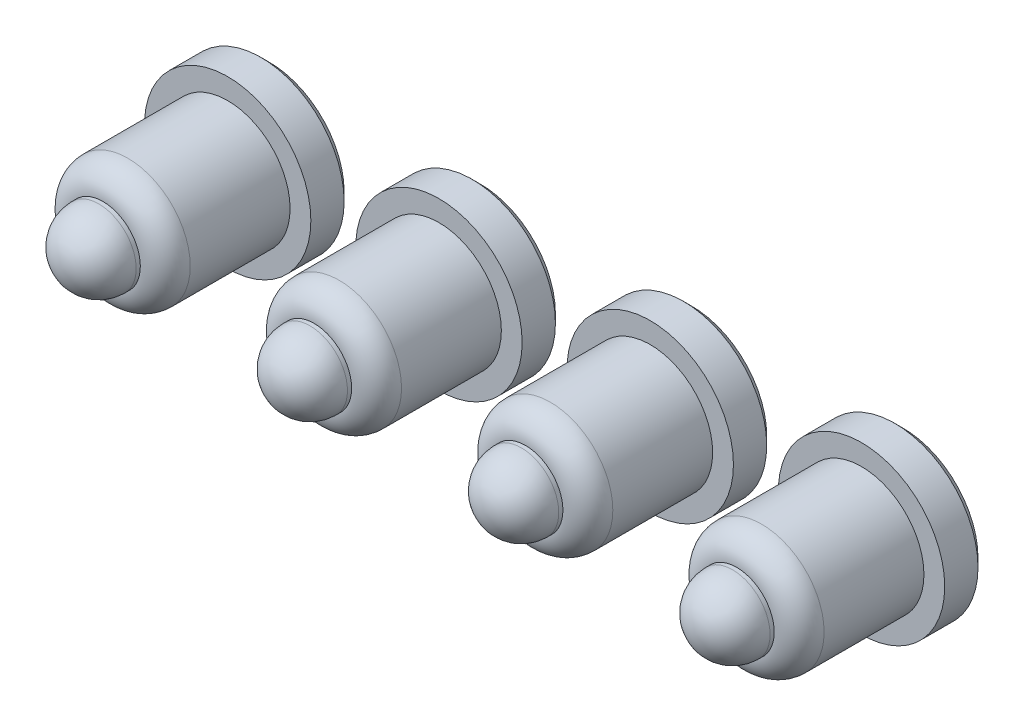
from build123d import *

# Parameters (mm, degrees)
SKETCH_1_R        = 0.75
EXTRUDE_1_DEPTH   = 1.5
EXTRUDE_1_2_DEPTH = 1.5
EXTRUDE_1_3_DEPTH = 1.5
EXTRUDE_1_4_DEPTH = 1.5
SKETCH_2_R        = 1
EXTRUDE_2_DEPTH   = 0.5
SKETCH_3_R        = 0.45
EXTRUDE_3_DEPTH   = 0.5
FILLET_1_R        = 0.3
FILLET_2_R        = 0.45
CHAMFER_1_SIZE    = 0.1
CHAMFER_2_SIZE    = 0.1
CHAMFER_3_SIZE    = 0.1
CHAMFER_4_SIZE    = 0.1
FILLET_3_R        = 0.3
FILLET_4_R        = 0.3
FILLET_5_R        = 0.3
FILLET_6_R        = 0.45
FILLET_7_R        = 0.45
FILLET_8_R        = 0.45


with BuildPart() as part:
    # 草图1 → 凸台-拉伸1 (new body)
    with BuildSketch(Plane.XY):
        Circle(SKETCH_1_R)
    extrude(amount=EXTRUDE_1_DEPTH)

    # 草图2 → 凸台-拉伸2 (add)
    with BuildSketch(Plane.XY):
        Circle(SKETCH_2_R)
        with Locations((2.54, 0)):
            Circle(SKETCH_2_R)
        with Locations((5.08, 0)):
            Circle(SKETCH_2_R)
        with Locations((7.62, 0)):
            Circle(SKETCH_2_R)
    extrude(amount=-EXTRUDE_2_DEPTH)


with BuildPart() as body_2:
    # 草图1 → Extrude 1 2 (new body)
    with BuildSketch(Plane.XY):
        with Locations((2.54, 0)):
            Circle(SKETCH_1_R)
    extrude(amount=EXTRUDE_1_2_DEPTH)

    # 圆角3
    fillet_3_edges = [body_2.edges().sort_by_distance(p)[0] for p in [
        (1.79, 0, 1.5),
    ]]
    fillet(fillet_3_edges, radius=FILLET_3_R)


with BuildPart() as body_3:
    # 草图1 → Extrude 1 3 (new body)
    with BuildSketch(Plane.XY):
        with Locations((5.08, 0)):
            Circle(SKETCH_1_R)
    extrude(amount=EXTRUDE_1_3_DEPTH)

    # 圆角4
    fillet_4_edges = [body_3.edges().sort_by_distance(p)[0] for p in [
        (4.33, 0, 1.5),
    ]]
    fillet(fillet_4_edges, radius=FILLET_4_R)


with BuildPart() as body_4:
    # 草图1 → Extrude 1 4 (new body)
    with BuildSketch(Plane.XY):
        with Locations((7.62, 0)):
            Circle(SKETCH_1_R)
    extrude(amount=EXTRUDE_1_4_DEPTH)

    # 圆角5
    fillet_5_edges = [body_4.edges().sort_by_distance(p)[0] for p in [
        (6.87, 0, 1.5),
    ]]
    fillet(fillet_5_edges, radius=FILLET_5_R)


with BuildPart() as extrude_2_piece_1:
    # of the separate pieces the step leaves, piece 1, a body of its own (extrude_2_pieces)
    add(part.part.solids().sort_by_distance((1, 0, 0))[0])

    # 草图3 → 凸台-拉伸3 (add)
    with BuildSketch(Plane.XY.offset(1.5)):
        Circle(SKETCH_3_R)
        with Locations((2.54, 0)):
            Circle(SKETCH_3_R)
        with Locations((5.08, 0)):
            Circle(SKETCH_3_R)
        with Locations((7.62, 0)):
            Circle(SKETCH_3_R)
    extrude(amount=EXTRUDE_3_DEPTH)


with BuildPart() as extrude_2_piece_2:
    # of the separate pieces the step leaves, piece 2, a body of its own (extrude_2_pieces)
    add(part.part.solids().sort_by_distance((3.54, 0, 0))[0])

    # 倒角1
    chamfer_1_edges = [extrude_2_piece_2.edges().sort_by_distance(p)[0] for p in [
        (1.54, 0, -0.5),
    ]]
    chamfer(chamfer_1_edges, length=CHAMFER_1_SIZE)


with BuildPart() as extrude_2_piece_3:
    # of the separate pieces the step leaves, piece 3, a body of its own (extrude_2_pieces)
    add(part.part.solids().sort_by_distance((6.08, 0, 0))[0])

    # 倒角3
    chamfer_3_edges = [extrude_2_piece_3.edges().sort_by_distance(p)[0] for p in [
        (4.08, 0, -0.5),
    ]]
    chamfer(chamfer_3_edges, length=CHAMFER_3_SIZE)


with BuildPart() as extrude_2_piece_4:
    # of the separate pieces the step leaves, piece 4, a body of its own (extrude_2_pieces)
    add(part.part.solids().sort_by_distance((8.62, 0, 0))[0])

    # 倒角4
    chamfer_4_edges = [extrude_2_piece_4.edges().sort_by_distance(p)[0] for p in [
        (6.62, 0, -0.5),
    ]]
    chamfer(chamfer_4_edges, length=CHAMFER_4_SIZE)


with BuildPart() as extrude_3_piece_1:
    # of the separate pieces the step leaves, piece 1, a body of its own (extrude_3_pieces)
    add(extrude_2_piece_1.part.solids().sort_by_distance((1, 0, 0))[0])

    # 圆角1
    fillet_1_edges = [extrude_3_piece_1.edges().sort_by_distance(p)[0] for p in [
        (-0.75, 0, 1.5),
    ]]
    fillet(fillet_1_edges, radius=FILLET_1_R - 0.0001)  # a hair under: the kernel refuses the full size

    # 圆角2
    fillet_2_edges = [extrude_3_piece_1.edges().sort_by_distance(p)[0] for p in [
        (-0.45, 0, 2),
    ]]
    fillet(fillet_2_edges, radius=FILLET_2_R)

    # 倒角2
    chamfer_2_edges = [extrude_3_piece_1.edges().sort_by_distance(p)[0] for p in [
        (-1, 0, -0.5),
    ]]
    chamfer(chamfer_2_edges, length=CHAMFER_2_SIZE)


with BuildPart() as extrude_3_piece_2:
    # of the separate pieces the step leaves, piece 2, a body of its own (extrude_3_pieces)
    add(extrude_2_piece_1.part.solids().sort_by_distance((2.99, 0, 1.5))[0])

    # 圆角6
    fillet_6_edges = [extrude_3_piece_2.edges().sort_by_distance(p)[0] for p in [
        (2.09, 0, 2),
    ]]
    fillet(fillet_6_edges, radius=FILLET_6_R)


with BuildPart() as extrude_3_piece_3:
    # of the separate pieces the step leaves, piece 3, a body of its own (extrude_3_pieces)
    add(extrude_2_piece_1.part.solids().sort_by_distance((5.53, 0, 1.5))[0])

    # 圆角7
    fillet_7_edges = [extrude_3_piece_3.edges().sort_by_distance(p)[0] for p in [
        (4.63, 0, 2),
    ]]
    fillet(fillet_7_edges, radius=FILLET_7_R)


with BuildPart() as extrude_3_piece_4:
    # of the separate pieces the step leaves, piece 4, a body of its own (extrude_3_pieces)
    add(extrude_2_piece_1.part.solids().sort_by_distance((8.07, 0, 1.5))[0])

    # 圆角8
    fillet_8_edges = [extrude_3_piece_4.edges().sort_by_distance(p)[0] for p in [
        (7.17, 0, 2),
    ]]
    fillet(fillet_8_edges, radius=FILLET_8_R)


solid = Compound([body_2.part, body_3.part, body_4.part, extrude_2_piece_2.part, extrude_2_piece_3.part, extrude_2_piece_4.part, extrude_3_piece_1.part, extrude_3_piece_2.part, extrude_3_piece_3.part, extrude_3_piece_4.part])
